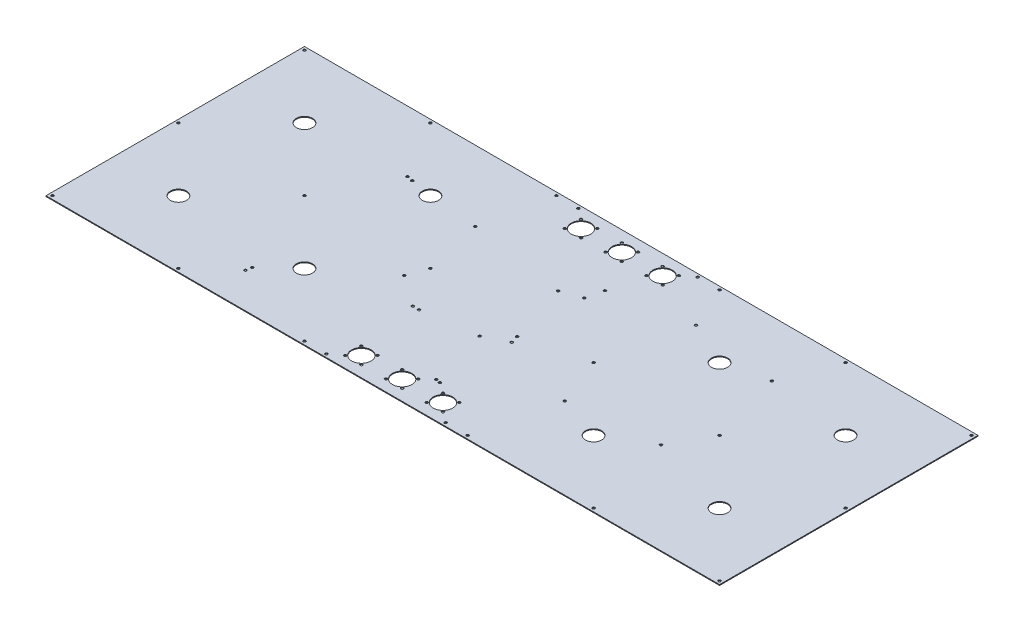
from build123d import *

# Parameters (mm, degrees)
MAIN_PLATE_W        = 834
MAIN_PLATE_H        = 320
BOSS_EXTRUDE1_DEPTH = 1.016
MAIN_HOLES_R        = 1.6
CUT_EXTRUDE1_DEPTH  = 447.64307031
SMA_R               = 10
CUT_EXTRUDE2_DEPTH  = 447.64307031
ADS9_EVAL_2_R       = 1.6
FULL_HOLES_DEPTH    = 448.008036295
FAN_R               = 1.6
FAN_R_2             = 12
CUT_EXTRUDE4_DEPTH  = 448.375011908


with BuildPart() as part:
    # main_plate → Boss-Extrude1 (new body)
    with BuildSketch(Plane(origin=(0, 0, 0), x_dir=(1, 0, 0), z_dir=(0, 1, 0))):
        Rectangle(MAIN_PLATE_W, MAIN_PLATE_H)
    extrude(amount=BOSS_EXTRUDE1_DEPTH)

    # main_holes → Cut-Extrude1 (cut, through all)
    with BuildSketch(Plane(origin=(0, 1.016, 0), x_dir=(1, 0, 0), z_dir=(0, 1, 0))):
        with Locations((-413, 156)):
            Circle(MAIN_HOLES_R)
        with Locations((-257, 156)):
            Circle(MAIN_HOLES_R)
        with Locations((-101, 156)):
            Circle(MAIN_HOLES_R)
        with Locations((-257, 0)):
            Circle(MAIN_HOLES_R)
        with Locations((-101, 0)):
            Circle(MAIN_HOLES_R)
        with Locations((-257, -156)):
            Circle(MAIN_HOLES_R)
        with Locations((-101, -156)):
            Circle(MAIN_HOLES_R)
        with Locations((-413, 0)):
            Circle(MAIN_HOLES_R)
        with Locations((-413, -156)):
            Circle(MAIN_HOLES_R)
        with Locations((413, -156)):
            Circle(MAIN_HOLES_R)
        with Locations((413, 0)):
            Circle(MAIN_HOLES_R)
        with Locations((101, -156)):
            Circle(MAIN_HOLES_R)
        with Locations((257, -156)):
            Circle(MAIN_HOLES_R)
        with Locations((101, 0)):
            Circle(MAIN_HOLES_R)
        with Locations((257, 0)):
            Circle(MAIN_HOLES_R)
        with Locations((101, 156)):
            Circle(MAIN_HOLES_R)
        with Locations((257, 156)):
            Circle(MAIN_HOLES_R)
        with Locations((413, 156)):
            Circle(MAIN_HOLES_R)
        with Locations((-73.81875, 156)):
            Circle(MAIN_HOLES_R)
        with Locations((73.81875, 156)):
            Circle(MAIN_HOLES_R)
        with Locations((73.81875, -156)):
            Circle(MAIN_HOLES_R)
        with Locations((-73.81875, -156)):
            Circle(MAIN_HOLES_R)
    extrude(amount=-CUT_EXTRUDE1_DEPTH, mode=Mode.SUBTRACT)

    # sma → Cut-Extrude2 (cut, through all)
    with BuildSketch(Plane(origin=(0, 1.016, 0), x_dir=(1, 0, 0), z_dir=(0, 1, 0))):
        with Locations((-335, 78)):
            Circle(SMA_R)
        with Locations((-179, 78)):
            Circle(SMA_R)
        with Locations((-179, -78)):
            Circle(SMA_R)
        with Locations((-335, -78)):
            Circle(SMA_R)
        with Locations((335, 78)):
            Circle(SMA_R)
        with Locations((179, 78)):
            Circle(SMA_R)
        with Locations((335, -78)):
            Circle(SMA_R)
        with Locations((179, -78)):
            Circle(SMA_R)
    extrude(amount=-CUT_EXTRUDE2_DEPTH, mode=Mode.SUBTRACT)

    # ads9_eval_2 → full_holes (cut, through all)
    with BuildSketch(Plane(origin=(0, 1.016, 1.016), x_dir=(1, 0, 0), z_dir=(0, 1, 0))):
        with Locations((124.354014482, 104.524146981)):
            Circle(ADS9_EVAL_2_R)
        with Locations((231.034014482, 91.766913394)):
            Circle(ADS9_EVAL_2_R)
        with Locations((230.960430802, -45.393066868)):
            Circle(ADS9_EVAL_2_R)
        with Locations((124.266804194, -58.035829625)):
            Circle(ADS9_EVAL_2_R)
        with Locations((-213.565632704, 85.178029062)):
            Circle(ADS9_EVAL_2_R)
        with Locations((-206.325632704, 83.858029062)):
            Circle(ADS9_EVAL_2_R)
        with Locations((-212.305632704, -108.301970938)):
            Circle(ADS9_EVAL_2_R)
        with Locations((-213.575632704, -115.481970938)):
            Circle(ADS9_EVAL_2_R)
        with Locations((-71.335632704, -50.391970938)):
            Circle(ADS9_EVAL_2_R)
        with Locations((-63.715632704, -50.391970938)):
            Circle(ADS9_EVAL_2_R)
        with Locations((2.144367296, -41.141970938)):
            Circle(ADS9_EVAL_2_R)
        with Locations((-109.615632704, -22.761970938)):
            Circle(ADS9_EVAL_2_R)
        with Locations((28.534367296, -27.851970938)):
            Circle(ADS9_EVAL_2_R)
        with Locations((25.824367296, -18.381970938)):
            Circle(ADS9_EVAL_2_R)
        with Locations((21.624367296, -114.521970938)):
            Circle(ADS9_EVAL_2_R)
        with Locations((27.266804194, -115.481970938)):
            Circle(ADS9_EVAL_2_R)
        with Locations((2.154367296, 55.888029062)):
            Circle(ADS9_EVAL_2_R)
        with Locations((25.984367296, 64.418029062)):
            Circle(ADS9_EVAL_2_R)
        with Locations((30.904367296, 85.178029062)):
            Circle(ADS9_EVAL_2_R)
        with Locations((-118.315632704, 73.788029062)):
            Circle(ADS9_EVAL_2_R)
    extrude(amount=-FULL_HOLES_DEPTH, mode=Mode.SUBTRACT)

    # fan → Cut-Extrude4 (cut, through all)
    with BuildSketch(Plane(origin=(0, 1.016, -2.032), x_dir=(1, 0, 0), z_dir=(0, -1, 0))):
        with Locations((-10, -123.968)):
            Circle(FAN_R)
        with Locations((10, -123.968)):
            Circle(FAN_R)
        with Locations((10, -143.968)):
            Circle(FAN_R)
        with Locations((-10, -143.968)):
            Circle(FAN_R)
        with Locations((0, -133.968)):
            Circle(FAN_R_2)
        with Locations((-60.5, -123.968)):
            Circle(FAN_R)
        with Locations((-40.5, -123.968)):
            Circle(FAN_R)
        with Locations((-40.5, -143.968)):
            Circle(FAN_R)
        with Locations((-60.5, -143.968)):
            Circle(FAN_R)
        with Locations((-50.5, -133.968)):
            Circle(FAN_R_2)
        with Locations((40.5, -123.968)):
            Circle(FAN_R)
        with Locations((60.5, -123.968)):
            Circle(FAN_R)
        with Locations((60.5, -143.968)):
            Circle(FAN_R)
        with Locations((40.5, -143.968)):
            Circle(FAN_R)
        with Locations((50.5, -133.968)):
            Circle(FAN_R_2)
        with Locations((-10, 148.032)):
            Circle(FAN_R)
        with Locations((10, 148.032)):
            Circle(FAN_R)
        with Locations((10, 128.032)):
            Circle(FAN_R)
        with Locations((-10, 128.032)):
            Circle(FAN_R)
        with Locations((0, 138.032)):
            Circle(FAN_R_2)
        with Locations((-60.5, 148.032)):
            Circle(FAN_R)
        with Locations((-40.5, 148.032)):
            Circle(FAN_R)
        with Locations((-40.5, 128.032)):
            Circle(FAN_R)
        with Locations((-60.5, 128.032)):
            Circle(FAN_R)
        with Locations((-50.5, 138.032)):
            Circle(FAN_R_2)
        with Locations((40.5, 148.032)):
            Circle(FAN_R)
        with Locations((60.5, 148.032)):
            Circle(FAN_R)
        with Locations((60.5, 128.032)):
            Circle(FAN_R)
        with Locations((40.5, 128.032)):
            Circle(FAN_R)
        with Locations((50.5, 138.032)):
            Circle(FAN_R_2)
    extrude(amount=CUT_EXTRUDE4_DEPTH, mode=Mode.SUBTRACT)


solid = part.part
